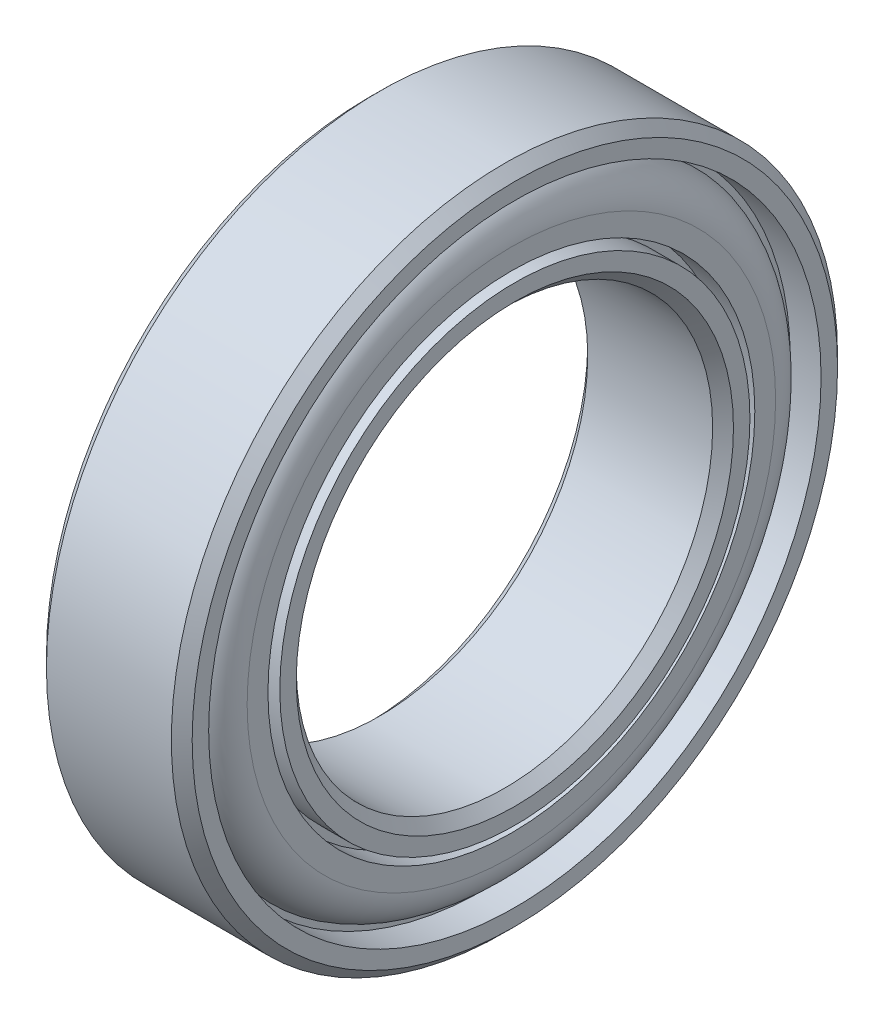
from build123d import *

# Parameters (mm, degrees)
SKETCH2_W     = 7
SKETCH2_H     = 6
FILLET1_R     = 1.8
CHAMFER1_SIZE = 0.5


with BuildPart() as part:
    # Sketch2 → Revolve1 (revolve)
    with BuildSketch(Plane.XY, mode=Mode.PRIVATE) as revolve1_sk:
        with Locations((0, 13)):
            Rectangle(SKETCH2_W, SKETCH2_H)
    revolve(revolve1_sk.sketch.rotate(Axis((0, 0, 0), (-1, 0, 0)), 90), axis=Axis((0, 0, 0), (-1, 0, 0)))

    # Sketch4 → Cut-Revolve1 (revolve, cut)
    with BuildSketch(Plane.XY, mode=Mode.PRIVATE) as cut_revolve1_sk:
        Polygon((6.594167107, 14.707924858), (2.022867053, 14.707924858), (2.022867053, 14.424029148), (3.332429366, 14.424029148), (3.332429366, 11.692719364), (2.022867053, 11.692719364), (2.022867053, 11.291318583), (6.594167107, 11.291318583), align=None)
        Polygon((-6.594167107, 11.291318583), (-6.594167107, 14.707924858), (-2.022867053, 14.707924858), (-2.022867053, 14.424029148), (-3.332429366, 14.424029148), (-3.332429366, 11.692719364), (-2.022867053, 11.692719364), (-2.022867053, 11.291318583), align=None)
    revolve(cut_revolve1_sk.sketch.rotate(Axis((0, 0, 0), (1, 0, 0)), 90), axis=Axis((0, 0, 0), (1, 0, 0)), mode=Mode.SUBTRACT)

    # Fillet1
    # the kernel refuses this fillet: 1.8 mm, written as the material it takes off along each edge
    with BuildSketch(Plane(origin=(3.332429366, 0, 0), x_dir=(0, 0, 1), z_dir=(0, 1, 0))) as fillet1_piece_1:
        with BuildLine():
            CenterArc((12.692131092, -1.8), FILLET1_R, 15.811024237, 74.188975763)
            Line((12.692131092, 0), (12.692131092, 0.036))
            Line((12.692131092, 0.036), (14.424029148, 0.036))
            Line((14.424029148, 0.036), (14.460029148, 0))
            ThreePointArc((14.460029148, 0), (14.460029148, -0.654781157), (14.458667109, -1.299753559))
            Line((14.458667109, -1.299753559), (14.424029148, -1.309562313))
        make_face()
    revolve(axis=Axis((3.332429366, 0, 0), (1, 0, 0)), mode=Mode.SUBTRACT)
    with BuildSketch(Plane(origin=(-3.332429366, 0, 0), x_dir=(0, 0, 1), z_dir=(0, 1, 0))) as fillet1_piece_2:
        with BuildLine():
            CenterArc((12.692131092, 1.8), FILLET1_R, 270, 74.188975763)
            Line((12.692131092, 0), (12.692131092, -0.036))
            Line((12.692131092, -0.036), (14.424029148, -0.036))
            Line((14.424029148, -0.036), (14.460029148, 0))
            ThreePointArc((14.460029148, 0), (14.460029148, 0.654781157), (14.458667109, 1.299753559))
            Line((14.458667109, 1.299753559), (14.424029148, 1.309562313))
        make_face()
    revolve(axis=Axis((-3.332429366, 0, 0), (1, 0, 0)), mode=Mode.SUBTRACT)

    # Chamfer1
    chamfer1_edges = [part.edges().sort_by_distance(p)[0] for p in [
        (3.5, 0, 10),
        (-3.5, 0, 10),
        (-3.5, 0, 16),
        (3.5, 0, 16),
    ]]
    chamfer(chamfer1_edges, length=CHAMFER1_SIZE)


solid = part.part
